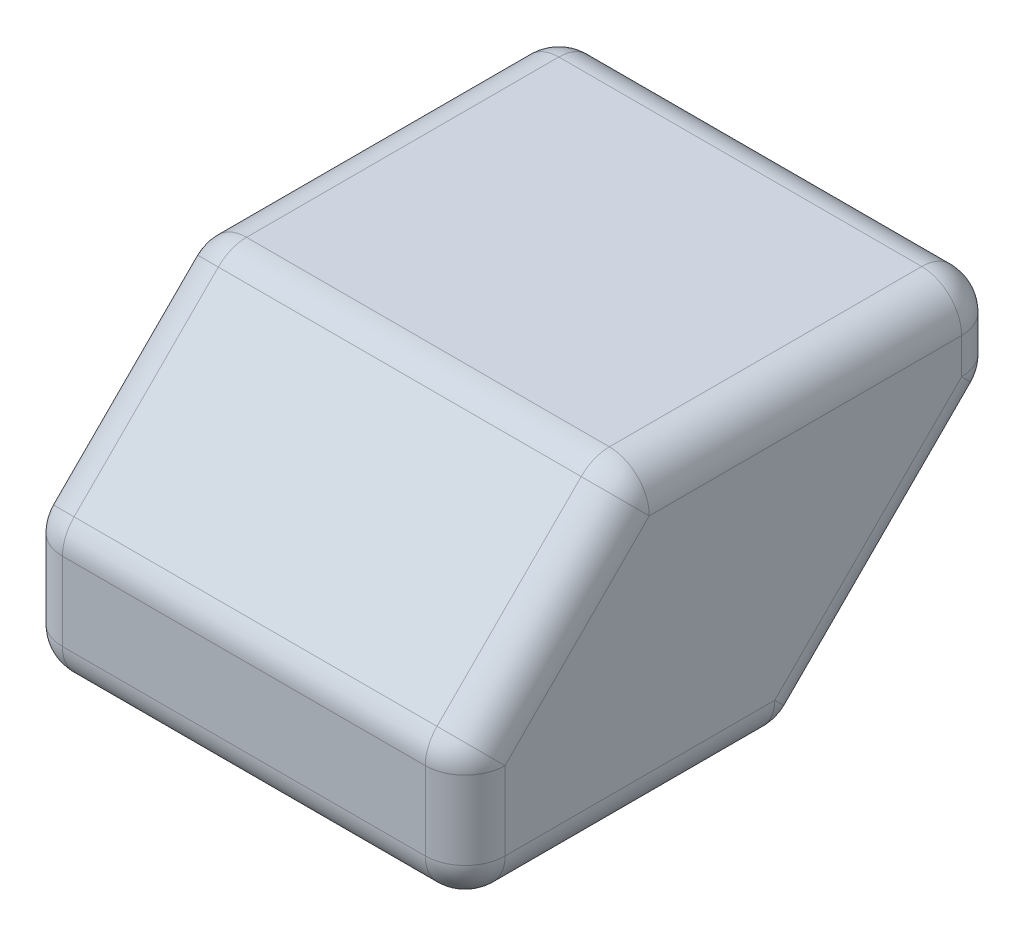
from build123d import *

# Parameters (mm, degrees)
SKETCH1_W           = 26.416
SKETCH1_H           = 32.004
BOSS_EXTRUDE1_DEPTH = 18.034
CHAMFER1_SIZE       = 12.54
CHAMFER2_SIZE       = 10
FILLET1_R           = 2.38


with BuildPart() as part:
    # Sketch1 → Boss-Extrude1 (new body)
    with BuildSketch(Plane(origin=(0, 0, 0), x_dir=(1, 0, 0), z_dir=(0, 1, 0))):
        with Locations((13.208, 16.002)):
            Rectangle(SKETCH1_W, SKETCH1_H)
    extrude(amount=BOSS_EXTRUDE1_DEPTH)

    # Chamfer1
    chamfer1_edges = [part.edges().sort_by_distance(p)[0] for p in [
        (13.208, 0, -32.004),
    ]]
    chamfer(chamfer1_edges, length=CHAMFER1_SIZE)

    # Chamfer2
    chamfer2_edges = [part.edges().sort_by_distance(p)[0] for p in [
        (13.208, 18.034, 0),
    ]]
    chamfer(chamfer2_edges, length=CHAMFER2_SIZE)

    # Fillet1
    fillet1_edges = [part.edges().sort_by_distance(p)[0] for p in [
        (0, 13.034, -5),
        (13.208, 8.034, 0),
        (26.416, 13.034, -5),
        (13.208, 18.034, -10),
        (26.416, 6.27, -25.734),
        (13.208, 0, -19.464),
        (0, 6.27, -25.734),
        (13.208, 12.54, -32.004),
        (0, 4.017, 0),
        (26.416, 4.017, 0),
        (26.416, 15.287, -32.004),
        (0, 15.287, -32.004),
        (13.208, 18.034, -32.004),
        (26.416, 18.034, -21.002),
        (0, 18.034, -21.002),
        (26.416, 0, -9.732),
        (13.208, 0, 0),
        (0, 0, -9.732),
    ]]
    fillet(fillet1_edges, radius=FILLET1_R)


solid = part.part
